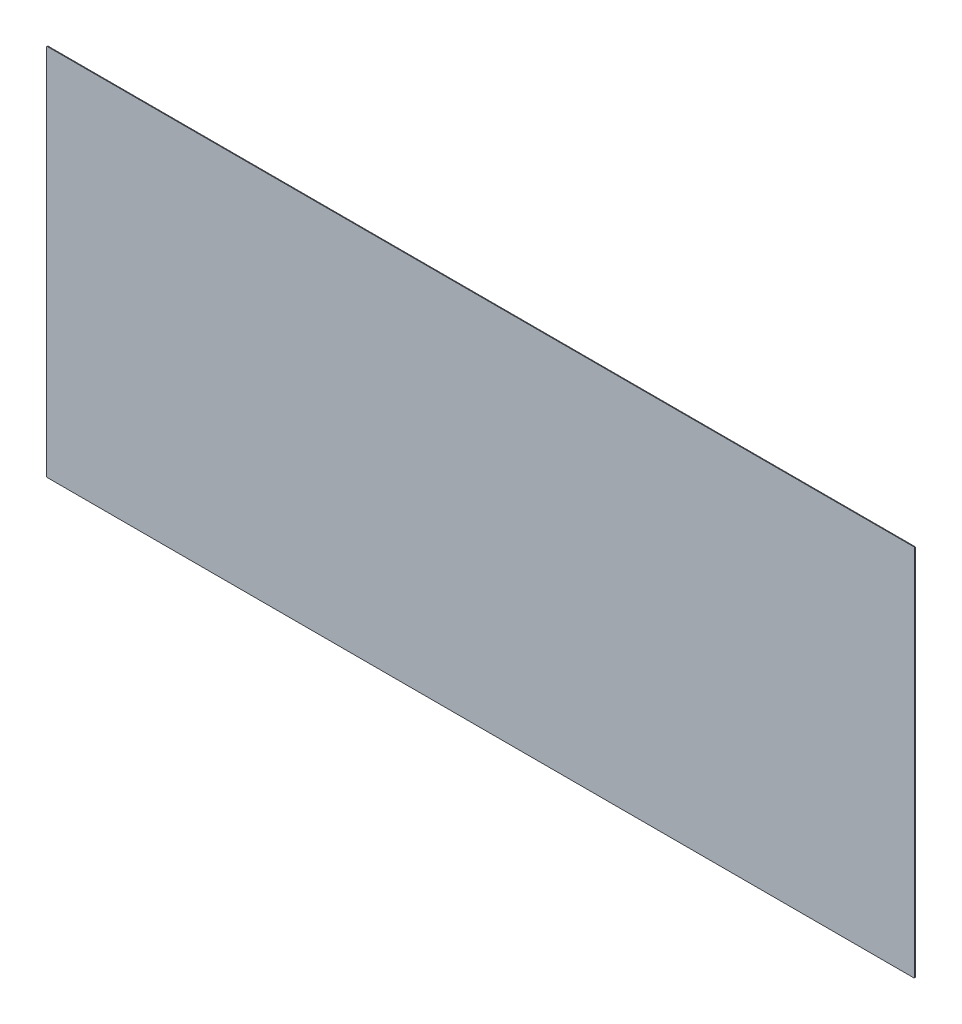
from build123d import *

# Parameters (mm, degrees)
BASE_FLANGE1_DEPTH = 1


# Sheet-metal steps are written as plain solids
with BuildPart() as part:
    # Sketch1 → Base-Flange1 (new body)
    with BuildSketch(Plane.XY):
        with BuildLine():
            Line((1, 0), (1159, 0))
            ThreePointArc((1159, 0), (1159.707106781, 0.292893219), (1160, 1))
            Line((1160, 1), (1160, 498))
            ThreePointArc((1160, 498), (1159.707106781, 498.707106781), (1159, 499))
            Line((1159, 499), (1, 499))
            ThreePointArc((1, 499), (0.292893219, 498.707106781), (0, 498))
            Line((0, 498), (0, 1))
            ThreePointArc((0, 1), (0.292893219, 0.292893219), (1, 0))
        make_face()
    extrude(amount=-BASE_FLANGE1_DEPTH)


solid = part.part
